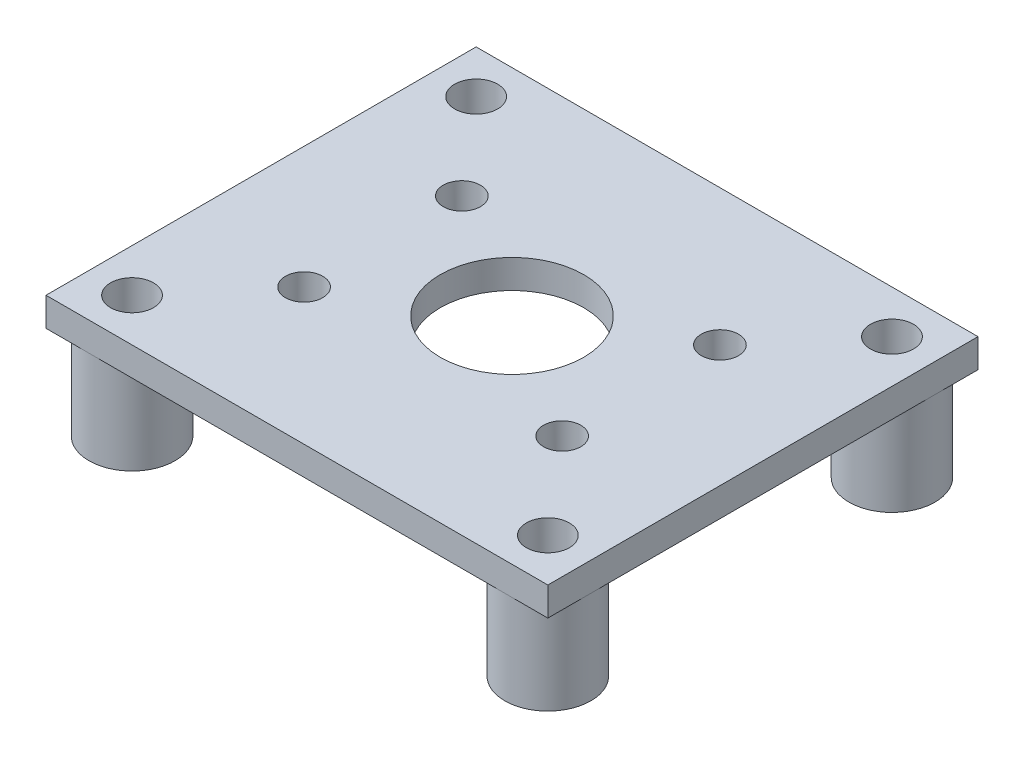
from build123d import *

# Parameters (mm, degrees)
SKETCH1_W           = 35
SKETCH1_H           = 30
BOSS_EXTRUDE1_DEPTH = 2
CUT_EXTRUDE1_REACH  = 25.135
SKETCH2_R           = 1.3
CUT_EXTRUDE2_REACH  = 25.135
SKETCH3_R           = 1.5
SKETCH4_R           = 3
BOSS_EXTRUDE2_DEPTH = 6.5
CUT_EXTRUDE3_REACH  = 25.948
SKETCH5_R           = 1.5
SKETCH7_R           = 5
CUT_EXTRUDE4_DEPTH  = 3


with BuildPart() as part:
    # Sketch1 → Boss-Extrude1 (new body)
    with BuildSketch(Plane(origin=(0, 0, 0), x_dir=(1, 0, 0), z_dir=(0, 1, 0))):
        Rectangle(SKETCH1_W, SKETCH1_H)
    extrude(amount=BOSS_EXTRUDE1_DEPTH)

    # Sketch2 → Cut-Extrude1 (cut, up to next)
    with BuildSketch(Plane(origin=(0, 2, 0), x_dir=(1, 0, 0), z_dir=(0, 1, 0)), mode=Mode.PRIVATE) as cut_extrude1_sk1:
        with Locations((9, 5.5)):
            Circle(SKETCH2_R)
    cut_extrude1_tool1 = extrude(cut_extrude1_sk1.sketch, amount=-CUT_EXTRUDE1_REACH, mode=Mode.PRIVATE) & part.part
    # Sketch2 → Cut-Extrude1 (cut, up to next)
    with BuildSketch(Plane(origin=(0, 2, 0), x_dir=(1, 0, 0), z_dir=(0, 1, 0)), mode=Mode.PRIVATE) as cut_extrude1_sk2:
        with Locations((-9, 5.5)):
            Circle(SKETCH2_R)
    cut_extrude1_tool2 = extrude(cut_extrude1_sk2.sketch, amount=-CUT_EXTRUDE1_REACH, mode=Mode.PRIVATE) & part.part
    # Sketch2 → Cut-Extrude1 (cut, up to next)
    with BuildSketch(Plane(origin=(0, 2, 0), x_dir=(1, 0, 0), z_dir=(0, 1, 0)), mode=Mode.PRIVATE) as cut_extrude1_sk3:
        with Locations((9, -5.5)):
            Circle(SKETCH2_R)
    cut_extrude1_tool3 = extrude(cut_extrude1_sk3.sketch, amount=-CUT_EXTRUDE1_REACH, mode=Mode.PRIVATE) & part.part
    # Sketch2 → Cut-Extrude1 (cut, up to next)
    with BuildSketch(Plane(origin=(0, 2, 0), x_dir=(1, 0, 0), z_dir=(0, 1, 0)), mode=Mode.PRIVATE) as cut_extrude1_sk4:
        with Locations((-9, -5.5)):
            Circle(SKETCH2_R)
    cut_extrude1_tool4 = extrude(cut_extrude1_sk4.sketch, amount=-CUT_EXTRUDE1_REACH, mode=Mode.PRIVATE) & part.part
    add(cut_extrude1_tool1.solids().sort_by_distance((9, 2, -5.5))[0], mode=Mode.SUBTRACT)
    add(cut_extrude1_tool2.solids().sort_by_distance((-9, 2, -5.5))[0], mode=Mode.SUBTRACT)
    add(cut_extrude1_tool3.solids().sort_by_distance((9, 2, 5.5))[0], mode=Mode.SUBTRACT)
    add(cut_extrude1_tool4.solids().sort_by_distance((-9, 2, 5.5))[0], mode=Mode.SUBTRACT)

    # Sketch3 → Cut-Extrude2 (cut, up to next)
    with BuildSketch(Plane.XZ, mode=Mode.PRIVATE) as cut_extrude2_sk1:
        with Locations((-14.5, 12)):
            Circle(SKETCH3_R)
    cut_extrude2_tool1 = extrude(cut_extrude2_sk1.sketch, amount=-CUT_EXTRUDE2_REACH, mode=Mode.PRIVATE) & part.part
    # Sketch3 → Cut-Extrude2 (cut, up to next)
    with BuildSketch(Plane.XZ, mode=Mode.PRIVATE) as cut_extrude2_sk2:
        with Locations((14.5, 12)):
            Circle(SKETCH3_R)
    cut_extrude2_tool2 = extrude(cut_extrude2_sk2.sketch, amount=-CUT_EXTRUDE2_REACH, mode=Mode.PRIVATE) & part.part
    # Sketch3 → Cut-Extrude2 (cut, up to next)
    with BuildSketch(Plane.XZ, mode=Mode.PRIVATE) as cut_extrude2_sk3:
        with Locations((14.5, -12)):
            Circle(SKETCH3_R)
    cut_extrude2_tool3 = extrude(cut_extrude2_sk3.sketch, amount=-CUT_EXTRUDE2_REACH, mode=Mode.PRIVATE) & part.part
    # Sketch3 → Cut-Extrude2 (cut, up to next)
    with BuildSketch(Plane.XZ, mode=Mode.PRIVATE) as cut_extrude2_sk4:
        with Locations((-14.5, -12)):
            Circle(SKETCH3_R)
    cut_extrude2_tool4 = extrude(cut_extrude2_sk4.sketch, amount=-CUT_EXTRUDE2_REACH, mode=Mode.PRIVATE) & part.part
    add(cut_extrude2_tool1.solids().sort_by_distance((-14.5, 0, 12))[0], mode=Mode.SUBTRACT)
    add(cut_extrude2_tool2.solids().sort_by_distance((14.5, 0, 12))[0], mode=Mode.SUBTRACT)
    add(cut_extrude2_tool3.solids().sort_by_distance((14.5, 0, -12))[0], mode=Mode.SUBTRACT)
    add(cut_extrude2_tool4.solids().sort_by_distance((-14.5, 0, -12))[0], mode=Mode.SUBTRACT)

    # Sketch4 → Boss-Extrude2 (add)
    with BuildSketch(Plane.XZ):
        with Locations((-14.5, 12)):
            Circle(SKETCH4_R)
        with Locations((14.5, 12)):
            Circle(SKETCH4_R)
        with Locations((-14.5, -12)):
            Circle(SKETCH4_R)
        with Locations((14.5, -12)):
            Circle(SKETCH4_R)
    extrude(amount=BOSS_EXTRUDE2_DEPTH)

    # Sketch5 → Cut-Extrude3 (cut, up to next)
    with BuildSketch(Plane(origin=(0, 0, 0), x_dir=(1, 0, 0), z_dir=(0, 1, 0)), mode=Mode.PRIVATE) as cut_extrude3_sk1:
        with Locations((-14.5, 12)):
            Circle(SKETCH5_R)
    cut_extrude3_tool1 = extrude(cut_extrude3_sk1.sketch, amount=-CUT_EXTRUDE3_REACH, mode=Mode.PRIVATE) & part.part
    # Sketch5 → Cut-Extrude3 (cut, up to next)
    with BuildSketch(Plane(origin=(0, 0, 0), x_dir=(1, 0, 0), z_dir=(0, 1, 0)), mode=Mode.PRIVATE) as cut_extrude3_sk2:
        with Locations((14.5, 12)):
            Circle(SKETCH5_R)
    cut_extrude3_tool2 = extrude(cut_extrude3_sk2.sketch, amount=-CUT_EXTRUDE3_REACH, mode=Mode.PRIVATE) & part.part
    # Sketch5 → Cut-Extrude3 (cut, up to next)
    with BuildSketch(Plane(origin=(0, 0, 0), x_dir=(1, 0, 0), z_dir=(0, 1, 0)), mode=Mode.PRIVATE) as cut_extrude3_sk3:
        with Locations((14.5, -12)):
            Circle(SKETCH5_R)
    cut_extrude3_tool3 = extrude(cut_extrude3_sk3.sketch, amount=-CUT_EXTRUDE3_REACH, mode=Mode.PRIVATE) & part.part
    # Sketch5 → Cut-Extrude3 (cut, up to next)
    with BuildSketch(Plane(origin=(0, 0, 0), x_dir=(1, 0, 0), z_dir=(0, 1, 0)), mode=Mode.PRIVATE) as cut_extrude3_sk4:
        with Locations((-14.5, -12)):
            Circle(SKETCH5_R)
    cut_extrude3_tool4 = extrude(cut_extrude3_sk4.sketch, amount=-CUT_EXTRUDE3_REACH, mode=Mode.PRIVATE) & part.part
    add(cut_extrude3_tool1.solids().sort_by_distance((-14.5, 0, -12))[0], mode=Mode.SUBTRACT)
    add(cut_extrude3_tool2.solids().sort_by_distance((14.5, 0, -12))[0], mode=Mode.SUBTRACT)
    add(cut_extrude3_tool3.solids().sort_by_distance((14.5, 0, 12))[0], mode=Mode.SUBTRACT)
    add(cut_extrude3_tool4.solids().sort_by_distance((-14.5, 0, 12))[0], mode=Mode.SUBTRACT)

    # Sketch7 → Cut-Extrude4 (cut)
    with BuildSketch(Plane(origin=(0, 2, 0), x_dir=(1, 0, 0), z_dir=(0, 1, 0))):
        Circle(SKETCH7_R)
    extrude(amount=-CUT_EXTRUDE4_DEPTH, mode=Mode.SUBTRACT)


solid = part.part
